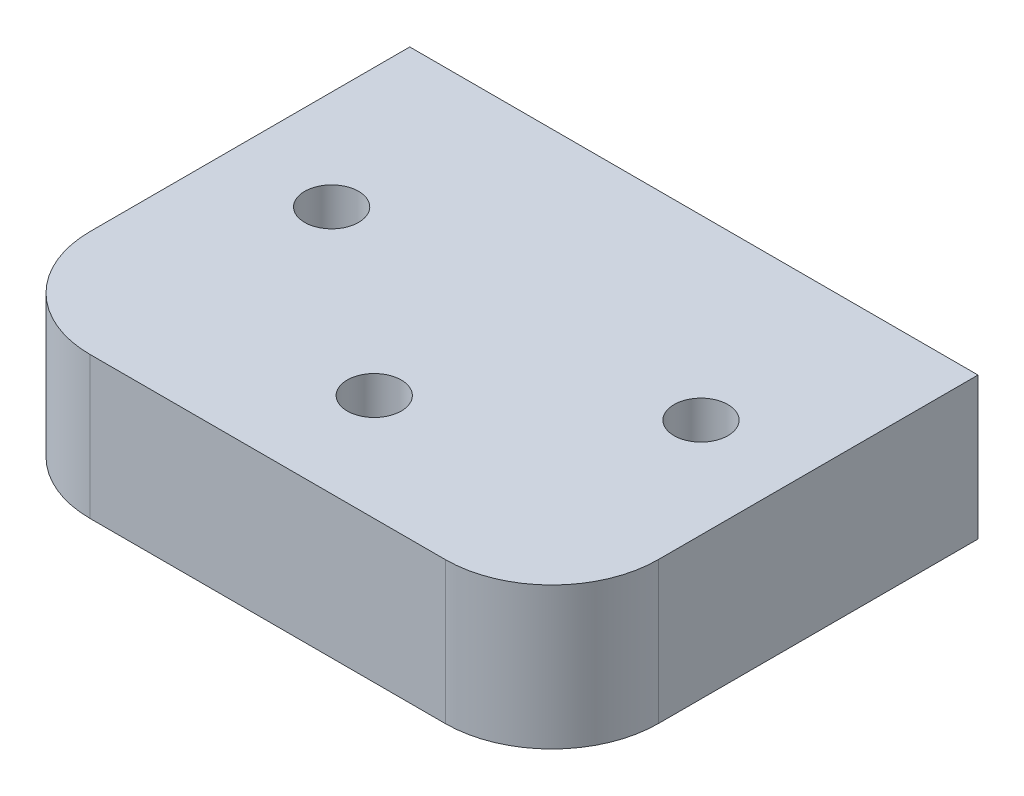
from build123d import *

# Parameters (mm, degrees)
BOSS_EXTRUDE1_DEPTH       = 10
F_6_CLEARANCE_HOLE1_D     = 3.7973
F_4_40_TAPPED_HOLE1_D     = 2.2606
F_4_40_TAPPED_HOLE1_DEPTH = 7.6
F_4_40_TAPPED_HOLE1_TIP   = 0.679152758


with BuildPart() as part:
    # Sketch1 → Boss-Extrude1 (new body)
    with BuildSketch(Plane(origin=(0, 0, 0), x_dir=(1, 0, 0), z_dir=(0, 1, 0))):
        with BuildLine():
            Line((0, 0), (40, 0))
            Line((40, 0), (40, -22.5))
            ThreePointArc((40, -22.5), (37.803300859, -27.803300859), (32.5, -30))
            Line((32.5, -30), (7.5, -30))
            ThreePointArc((7.5, -30), (2.196699141, -27.803300859), (0, -22.5))
            Line((0, -22.5), (0, 0))
        make_face()
    extrude(amount=BOSS_EXTRUDE1_DEPTH)

    # #6 Clearance Hole1 (through all)
    with Locations(Plane(origin=(0, 10, 0), x_dir=(1, 0, 0), z_dir=(0, 1, 0))):
        with Locations((7, -12.5), (33, -12.5), (20, -22.5)):
            Hole(F_6_CLEARANCE_HOLE1_D / 2)

    # #4-40 Tapped Hole1
    with Locations(Plane(origin=(0, 0, 0), x_dir=(-1, 0, 0), z_dir=(0, 0, -1))):
        with Locations((-32.5, 5), (-20, 5), (-7.5, 5)):
            Hole(F_4_40_TAPPED_HOLE1_D / 2, depth=F_4_40_TAPPED_HOLE1_DEPTH)
            with Locations((0, 0, -(F_4_40_TAPPED_HOLE1_DEPTH + F_4_40_TAPPED_HOLE1_TIP / 2))):  # 118° drill point
                Cone(0, F_4_40_TAPPED_HOLE1_D / 2, F_4_40_TAPPED_HOLE1_TIP, mode=Mode.SUBTRACT)


solid = part.part
